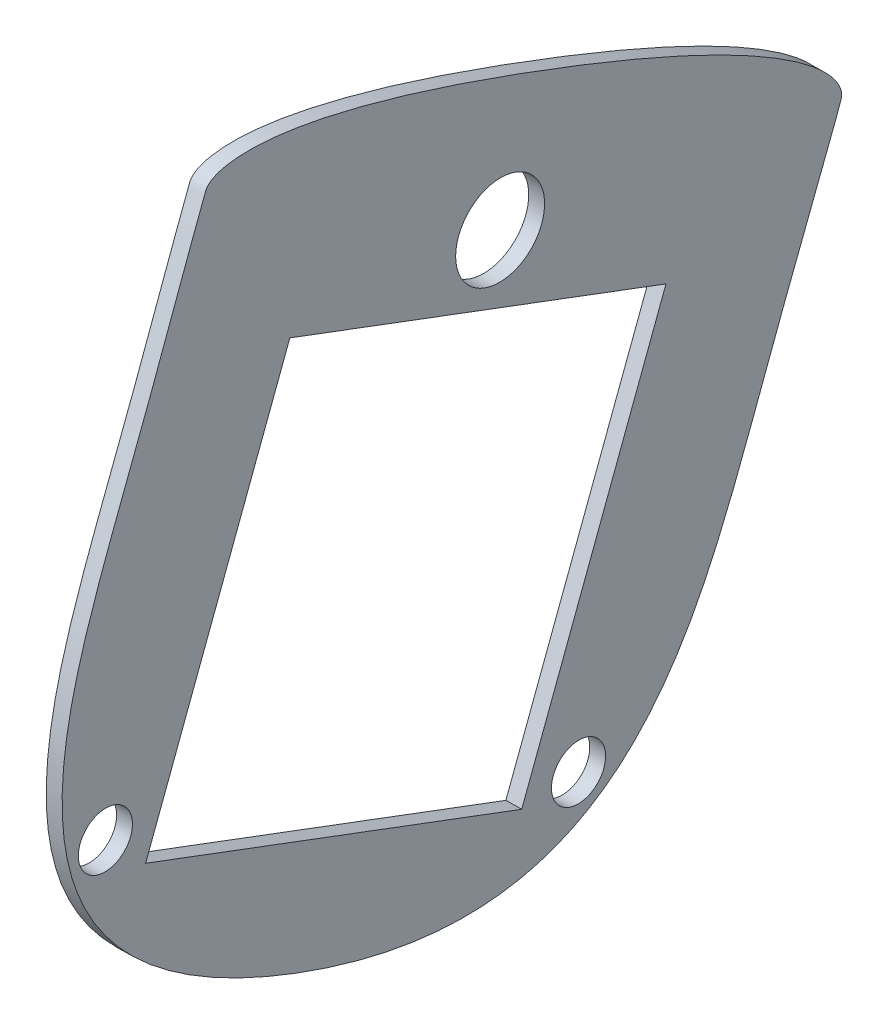
from build123d import *

# Parameters (mm, degrees)
SKETCH3_R               = 11.5
SKETCH3_R_2             = 7
BOSS_EXTRUDE1_DEPTH     = 4
CUT_EXTRUDE1_DEPTH      = 215.260535492
CUT_EXTRUDE1_DEPTH_BACK = 215.260535492


with BuildPart() as part:
    # Sketch3 → Boss-Extrude1 (new body)
    with BuildSketch(Plane(origin=(-1179.548631244, -0.000116963, 14.971959902), x_dir=(0.012691934504714668, 1.258519915397729e-09, 0.9999194541554475), z_dir=(-0.9999194541554426, -9.915104323779702e-08, 0.01269193450471473))):
        with BuildLine():
            add(Edge.make_bspline(
                [(84.377905998, 170.073349611), (84.159146209, 170.614103737), (83.611445829, 171.645847401), (82.482488155, 172.968186199), (81.127474205, 174.032815338), (79.625504141, 174.851852168), (78.048065363, 175.46773216), (75.883744714, 176.067351893), (73.137504594, 176.493777281), (69.848329994, 176.668544918), (66.593182125, 176.609478461), (63.378982778, 176.382288344), (60.20731945, 176.028236357), (57.075408808, 175.575862287), (53.980573733, 175.044418403), (50.919287132, 174.448332656), (47.88858994, 173.797522358), (44.885549546, 173.100779506), (40.914701349, 172.117751202), (36.006584389, 170.801928289), (30.186228838, 169.112782921), (24.416677375, 167.331209331), (18.680858867, 165.470954437), (12.962867526, 163.537381585), (7.246752851, 161.536551279), (-0.392782545, 158.779747051), (-6.165961293, 156.613052059), (-13.94829591, 153.628587787), (-19.689671295, 151.379544623), (-27.213353042, 148.32138638), (-32.801411813, 145.987168864), (-38.34590917, 143.60168497), (-43.854658394, 141.149761563), (-49.33590569, 138.616774109), (-54.793159015, 135.98108416), (-59.322515753, 133.677749539), (-62.932447741, 131.753643877), (-65.631328698, 130.263773352), (-68.320076039, 128.721252072), (-70.99499306, 127.117580989), (-73.651650051, 125.443406131), (-76.283024477, 123.685640179), (-78.878235649, 121.828176014), (-81.420273295, 119.847929263), (-83.880369486, 117.71527683), (-86.209443734, 115.385980118), (-87.966528206, 113.232572142), (-89.175083533, 111.339467663), (-89.936337543, 109.826689125), (-90.505629637, 108.213285186), (-90.801403008, 106.515492236), (-90.756707116, 104.777199898), (-90.474046755, 103.643699911), (-90.084384795, 102.569480158), (-89.841034016, 101.911994363), (-89.541465442, 101.124116148), (-89.39022558, 100.730499307), (-89.238048509, 100.337045258), (-89.085953699, 99.943392047), (-88.933536811, 99.549679266), (-88.730132992, 99.024564877), (-88.373481405, 98.105259575), (-87.862190511, 96.790888427), (-87.245924635, 95.211881522), (-86.627148474, 93.631055189), (-86.006043621, 92.048360056), (-85.382804113, 90.46374254), (-84.757617465, 88.87715131), (-84.130649567, 87.288544234), (-83.502064493, 85.697879827), (-82.662014846, 83.574195152), (-81.608733884, 80.914237535), (-80.340964507, 77.713392714), (-79.070680925, 74.503319887), (-77.799405763, 71.283624353), (-76.528661796, 68.053911872), (-75.259433457, 64.814004725), (-73.992705385, 61.563725615), (-72.730871393, 58.302409625), (-71.476325612, 55.029392149), (-69.810026434, 50.651412822), (-67.733040223, 45.155857397), (-65.192889969, 38.548535597), (-63.002092293, 33.047031135), (-61.179682785, 28.661451936), (-60.006324985, 25.929654584), (-59.043849556, 23.751341903), (-58.309275854, 22.121773372), (-57.56111242, 20.496992747), (-56.798597272, 18.877580965), (-56.02074925, 17.264200326), (-55.227016605, 15.657353665), (-54.415921139, 14.057888772), (-52.755061989, 10.875871272), (-50.113640526, 6.170533326), (-46.214055624, 0.106202959), (-41.879815211, -5.682640377), (-37.071022669, -11.095491143), (-31.749304366, -16.030968238), (-26.892659915, -19.643471605), (-22.77171096, -22.182742504), (-18.509010649, -24.473419396), (-12.935749295, -26.848778135), (-5.968718292, -28.897564796), (1.173532604, -30.167771585), (8.394625718, -30.72426012), (15.629246847, -30.639249774), (22.822176795, -29.99272502), (29.944943646, -28.856179071), (36.971413373, -27.310529127), (46.200981004, -24.782274948), (52.958186926, -22.450860484), (61.81972476, -19.052528076), (68.404073328, -16.267470827), (76.95838131, -11.975451151), (83.217088787, -8.426029178), (89.273667966, -4.508006235), (95.054577362, -0.17870119), (100.490854379, 4.595986977), (105.487967549, 9.838586932), (109.949080227, 15.559099084), (113.759190042, 21.741276151), (116.314593096, 27.234185766), (117.952211322, 31.787728825), (119.31821366, 36.431290069), (120.513597166, 42.364707849), (121.170203082, 49.592689871), (121.126324228, 56.832595149), (120.478268293, 64.034720651), (119.322900557, 71.151036814), (118.140760893, 76.415668184), (117.248089102, 79.892054693), (116.781726531, 81.623608795), (116.297499658, 83.349034553), (115.797104501, 85.068701615), (115.281277137, 86.782601375), (114.751194296, 88.490899321), (114.207808244, 90.193672228), (113.466976478, 92.456831493), (112.512877939, 95.2725252), (110.935633256, 99.751829279), (108.886186051, 105.307189462), (106.357132583, 111.918384124), (104.227035857, 117.393292318), (102.538795023, 121.76266191), (101.283192002, 125.035142736), (100.040826281, 128.303809705), (98.809473322, 131.567557235), (97.586908616, 134.825280211), (96.372281382, 138.076452947), (95.164740704, 141.32055023), (93.962890537, 144.556847836), (92.765334624, 147.784622), (91.769947764, 150.466802963), (90.974582637, 152.607652643), (90.37838073, 154.210763325), (89.782350048, 155.811268218), (89.186340893, 157.409088573), (88.590201531, 159.004144829), (87.993758439, 160.596349912), (87.396830825, 162.185613775), (86.799251704, 163.771852109), (86.300563928, 165.091116339), (85.951056972, 166.013206231), (85.751175589, 166.539698033), (85.601252796, 166.934387123), (85.451115071, 167.328812398), (85.301183692, 167.723146525), (85.150455373, 168.116984379), (84.846354037, 168.903163888), (84.587677769, 169.554813042), (84.377905998, 170.073349611)],
                knots=[0, 0, 0, 0, 0.002677759, 0.005355518, 0.008033277, 0.010711036, 0.013388795, 0.016066554, 0.021422071, 0.026777589, 0.032133107, 0.037488625, 0.042844143, 0.048199661, 0.053555179, 0.058910696, 0.064266214, 0.069621732, 0.07497725, 0.085688286, 0.096399321, 0.107110357, 0.117821393, 0.128532429, 0.139243464, 0.1499545, 0.171376571, 0.171376571, 0.192798208, 0.203509027, 0.214219845, 0.224930663, 0.235641482, 0.2463523, 0.257063118, 0.267773937, 0.273129346, 0.278484755, 0.283840164, 0.289195574, 0.294550983, 0.299906392, 0.305261801, 0.31061721, 0.31597262, 0.321328029, 0.326683438, 0.329361143, 0.332038847, 0.334716552, 0.337394256, 0.340071961, 0.342749665, 0.342749665, 0.345316694, 0.345958451, 0.346600208, 0.347241965, 0.347883722, 0.348525479, 0.349167236, 0.350450751, 0.353017779, 0.355584807, 0.358151836, 0.360718864, 0.363285893, 0.365852921, 0.368419949, 0.370986978, 0.373554006, 0.378688063, 0.38382212, 0.388956176, 0.394090233, 0.39922429, 0.404358347, 0.409492403, 0.41462646, 0.419760517, 0.424894574, 0.435162687, 0.445430801, 0.455698914, 0.460832971, 0.465967028, 0.468534056, 0.471101084, 0.473668113, 0.476235141, 0.478802169, 0.481369198, 0.483936226, 0.486503255, 0.496771368, 0.507039482, 0.517307595, 0.527575709, 0.537843822, 0.548111936, 0.553245992, 0.558380049, 0.568648163, 0.578916276, 0.58918439, 0.599452503, 0.609720617, 0.61998873, 0.630256844, 0.640524957, 0.650793071, 0.671329298, 0.671329298, 0.691871217, 0.702142176, 0.712413135, 0.722684095, 0.732955054, 0.743226014, 0.753496973, 0.763767933, 0.774038892, 0.784309852, 0.789445331, 0.794580811, 0.80485177, 0.81512273, 0.825393689, 0.835664649, 0.845935608, 0.856206568, 0.858774308, 0.861342047, 0.863909787, 0.866477527, 0.869045267, 0.871613007, 0.874180747, 0.876748487, 0.881883966, 0.887019446, 0.897290406, 0.907561365, 0.917832324, 0.922967804, 0.928103284, 0.933238764, 0.938374243, 0.943509723, 0.948645203, 0.953780682, 0.958916162, 0.964051642, 0.969187122, 0.971754862, 0.974322601, 0.976890341, 0.979458081, 0.982025821, 0.984593561, 0.987161301, 0.989729041, 0.99229678, 0.99358065, 0.994222585, 0.99486452, 0.995506455, 0.99614839, 0.996790325, 0.99743226, 1, 1, 1, 1], degree=3))
        make_face()
        with Locations((3.088369787, 120.842225121)):
            Circle(SKETCH3_R, mode=Mode.SUBTRACT)
        with Locations((-17.186648299, -9.215855238)):
            Circle(SKETCH3_R_2, mode=Mode.SUBTRACT)
        Polygon((94.736446449, 27.279702875), (-2.498711879, -10.009217528), (-39.787632282, 87.2259408), (57.447526046, 124.514861203), align=None, mode=Mode.SUBTRACT)
        with Locations((105.127599262, 37.690699139)):
            Circle(SKETCH3_R_2, mode=Mode.SUBTRACT)
    extrude(amount=-BOSS_EXTRUDE1_DEPTH)

    # Sketch7 → Cut-Extrude1 (cut, two sides: drawn at the far end of the back side and taken through both)
    with BuildSketch(Plane(origin=(-1175.548953427, -0.000116566, 14.921192164), x_dir=(-0.012691934504714949, -1.2585199174118205e-09, -0.9999194541554475), z_dir=(0.9999194541554426, 9.915104339647264e-08, -0.012691934504715011)).offset(-CUT_EXTRUDE1_DEPTH_BACK)):
        with BuildLine():
            add(Edge.make_bspline(
                [(-84.377905998, 170.073349611), (-84.587677769, 169.554813042), (-84.846354037, 168.903163888), (-85.150455373, 168.116984379), (-85.301183692, 167.723146525), (-85.451115071, 167.328812398), (-85.601252796, 166.934387123), (-85.751175589, 166.539698033), (-85.951056972, 166.013206232), (-86.300563928, 165.091116339), (-86.799251704, 163.771852109), (-87.396830825, 162.185613775), (-87.993758439, 160.596349912), (-88.590201531, 159.004144829), (-89.186340893, 157.409088573), (-89.782350048, 155.811268218), (-90.37838073, 154.210763325), (-90.974582637, 152.607652643), (-91.769947764, 150.466802963), (-92.765334624, 147.784622001), (-93.962890537, 144.556847836), (-95.164740704, 141.32055023), (-96.372281382, 138.076452947), (-97.586908616, 134.825280211), (-98.809473322, 131.567557235), (-100.040826281, 128.303809705), (-101.283192002, 125.035142736), (-102.538795023, 121.76266191), (-104.227035857, 117.393292318), (-106.357132583, 111.918384124), (-108.886186051, 105.307189462), (-110.935633256, 99.751829279), (-112.512877939, 95.2725252), (-113.466976478, 92.456831493), (-114.207808244, 90.193672228), (-114.751194296, 88.490899321), (-115.281277137, 86.782601375), (-115.797104501, 85.068701616), (-116.297499658, 83.349034553), (-116.781726531, 81.623608795), (-117.248089102, 79.892054693), (-118.140760893, 76.415668184), (-119.322900557, 71.151036814), (-120.478268293, 64.034720651), (-121.126324228, 56.832595149), (-121.170203082, 49.592689871), (-120.513597166, 42.364707849), (-119.31821366, 36.431290069), (-117.952211322, 31.787728825), (-116.314593096, 27.234185766), (-113.759190042, 21.741276151), (-109.949080227, 15.559099084), (-105.487967549, 9.838586932), (-100.490854379, 4.595986977), (-95.054577362, -0.17870119), (-89.273667966, -4.508006235), (-83.217088787, -8.426029178), (-76.95838131, -11.975451151), (-68.404073328, -16.267470827), (-61.81972476, -19.052528076), (-52.958186926, -22.450860484), (-46.200981004, -24.782274948), (-36.971413373, -27.310529127), (-29.944943646, -28.856179071), (-22.822176795, -29.99272502), (-15.629246847, -30.639249774), (-8.394625718, -30.72426012), (-1.173532604, -30.167771585), (5.968718292, -28.897564796), (12.935749295, -26.848778135), (18.509010649, -24.473419396), (22.77171096, -22.182742504), (26.892659915, -19.643471605), (31.749304366, -16.030968238), (37.071022669, -11.095491143), (41.879815211, -5.682640377), (46.214055624, 0.106202959), (50.113640526, 6.170533326), (52.755061989, 10.875871272), (54.415921139, 14.057888772), (55.227016605, 15.657353665), (56.02074925, 17.264200326), (56.798597272, 18.877580965), (57.561112421, 20.496992747), (58.309275854, 22.121773372), (59.043849556, 23.751341903), (60.006324985, 25.929654584), (61.179682785, 28.661451936), (63.002092293, 33.047031135), (65.192889969, 38.548535597), (67.733040223, 45.155857397), (69.810026434, 50.651412822), (71.476325612, 55.029392149), (72.730871393, 58.302409625), (73.992705385, 61.563725615), (75.259433457, 64.814004725), (76.528661796, 68.053911872), (77.799405763, 71.283624353), (79.070680925, 74.503319887), (80.340964507, 77.713392714), (81.608733884, 80.914237535), (82.662014846, 83.574195152), (83.502064493, 85.697879827), (84.130649567, 87.288544235), (84.757617465, 88.87715131), (85.382804113, 90.46374254), (86.006043621, 92.048360056), (86.627148474, 93.631055189), (87.245924635, 95.211881522), (87.862190511, 96.790888427), (88.373481405, 98.105259575), (88.730132992, 99.024564877), (88.933536811, 99.549679266), (89.085953699, 99.943392047), (89.238048509, 100.337045258), (89.39022558, 100.730499307), (89.541465442, 101.124116148), (89.841034016, 101.911994363), (90.084384795, 102.569480158), (90.474046755, 103.643699911), (90.756707116, 104.777199898), (90.801403008, 106.515492236), (90.505629637, 108.213285186), (89.936337543, 109.826689125), (89.175083533, 111.339467663), (87.966528206, 113.232572142), (86.209443734, 115.385980118), (83.880369486, 117.71527683), (81.420273295, 119.847929263), (78.878235649, 121.828176014), (76.283024477, 123.685640179), (73.651650051, 125.443406131), (70.99499306, 127.117580989), (68.320076039, 128.721252072), (65.631328698, 130.263773352), (62.932447741, 131.753643877), (59.322515753, 133.677749539), (54.793159015, 135.98108416), (49.33590569, 138.616774109), (43.854658394, 141.149761563), (38.34590917, 143.60168497), (32.801411813, 145.987168864), (27.213353042, 148.32138638), (19.689671295, 151.379544623), (13.94829591, 153.628587787), (6.165961293, 156.613052059), (0.392782545, 158.779747051), (-7.246752851, 161.536551279), (-12.962867526, 163.537381585), (-18.680858867, 165.470954437), (-24.416677375, 167.331209331), (-30.186228838, 169.112782921), (-36.006584389, 170.801928289), (-40.914701349, 172.117751202), (-44.885549546, 173.100779506), (-47.88858994, 173.797522358), (-50.919287132, 174.448332656), (-53.980573733, 175.044418403), (-57.075408808, 175.575862287), (-60.20731945, 176.028236357), (-63.378982778, 176.382288344), (-66.593182125, 176.609478461), (-69.848329994, 176.668544918), (-73.137504594, 176.493777281), (-75.883744714, 176.067351893), (-78.048065363, 175.46773216), (-79.625504141, 174.851852168), (-81.127474205, 174.032815338), (-82.482488155, 172.968186199), (-83.611445829, 171.645847401), (-84.159146209, 170.614103737), (-84.377905998, 170.073349611)],
                knots=[0, 0, 0, 0, 0.00256774, 0.003209675, 0.00385161, 0.004493545, 0.00513548, 0.005777415, 0.00641935, 0.00770322, 0.010270959, 0.012838699, 0.015406439, 0.017974179, 0.020541919, 0.023109659, 0.025677399, 0.028245138, 0.030812878, 0.035948358, 0.041083838, 0.046219318, 0.051354797, 0.056490277, 0.061625757, 0.066761236, 0.071896716, 0.077032196, 0.082167676, 0.092438635, 0.102709594, 0.112980554, 0.118116034, 0.123251513, 0.125819253, 0.128386993, 0.130954733, 0.133522473, 0.136090213, 0.138657953, 0.141225692, 0.143793432, 0.154064392, 0.164335351, 0.174606311, 0.18487727, 0.19514823, 0.205419189, 0.210554669, 0.215690148, 0.225961108, 0.236232067, 0.246503027, 0.256773986, 0.267044946, 0.277315905, 0.287586865, 0.297857824, 0.308128783, 0.328670702, 0.328670702, 0.349206929, 0.359475043, 0.369743156, 0.38001127, 0.390279383, 0.400547497, 0.41081561, 0.421083724, 0.431351837, 0.441619951, 0.446754008, 0.451888064, 0.462156178, 0.472424291, 0.482692405, 0.492960518, 0.503228632, 0.513496745, 0.516063774, 0.518630802, 0.521197831, 0.523764859, 0.526331887, 0.528898916, 0.531465944, 0.534032972, 0.539167029, 0.544301086, 0.554569199, 0.564837313, 0.575105426, 0.580239483, 0.58537354, 0.590507597, 0.595641653, 0.60077571, 0.605909767, 0.611043824, 0.61617788, 0.621311937, 0.626445994, 0.629013022, 0.631580051, 0.634147079, 0.636714107, 0.639281136, 0.641848164, 0.644415193, 0.646982221, 0.649549249, 0.650832764, 0.651474521, 0.652116278, 0.652758035, 0.653399792, 0.654041549, 0.654683306, 0.657250335, 0.657250335, 0.659928039, 0.662605744, 0.665283448, 0.667961153, 0.670638857, 0.673316562, 0.678671971, 0.68402738, 0.68938279, 0.694738199, 0.700093608, 0.705449017, 0.710804426, 0.716159836, 0.721515245, 0.726870654, 0.732226063, 0.742936882, 0.7536477, 0.764358518, 0.775069337, 0.785780155, 0.796490973, 0.807201792, 0.828623429, 0.828623429, 0.8500455, 0.860756536, 0.871467571, 0.882178607, 0.892889643, 0.903600679, 0.914311714, 0.92502275, 0.930378268, 0.935733786, 0.941089304, 0.946444821, 0.951800339, 0.957155857, 0.962511375, 0.967866893, 0.973222411, 0.978577929, 0.983933446, 0.986611205, 0.989288964, 0.991966723, 0.994644482, 0.997322241, 1, 1, 1, 1], degree=3))
        make_face()
        with BuildLine():
            add(Edge.make_bspline(
                [(-55.838187915, -16.709006158), (-52.759337993, -17.889720929), (-49.661983589, -18.990343474), (-43.424834759, -21.007897071), (-40.285339262, -21.92612196), (-33.955770812, -23.543659309), (-30.765739772, -24.24315318), (-24.32356293, -25.373292006), (-21.071285211, -25.803365996), (-16.956515513, -26.12704479), (-16.131072797, -26.18100847), (-14.474843152, -26.265804691), (-13.644083081, -26.296583324), (-11.159336056, -26.351552112), (-9.507722379, -26.338718419), (-4.568918462, -26.137757417), (-1.297671373, -25.78812208), (2.759472487, -25.027771111), (3.569293765, -24.859416605), (5.18553302, -24.488231331), (5.993775065, -24.284843954), (8.399228786, -23.623868124), (9.971586965, -23.117864588), (14.595084925, -21.404330612), (17.551875198, -19.999661802), (21.794962334, -17.491279284), (23.177855615, -16.589398743), (25.205437224, -15.138878878), (25.873321198, -14.639057008), (27.181089471, -13.616839589), (27.822584958, -13.093252227), (30.970670356, -10.4154919), (33.301166003, -8.083945357), (36.567419281, -4.355468118), (37.618355142, -3.072810403), (39.64697293, -0.440910656), (40.616764166, 0.897801763), (43.411580637, 4.972513852), (45.123166514, 7.766516767), (48.319174964, 13.470674596), (49.801929662, 16.381682321), (52.604978459, 22.286766309), (53.932733365, 25.27702775), (57.766509572, 34.324247789), (60.125505586, 40.458843727), (63.606479117, 49.676665059), (64.757269397, 52.752894779), (67.079227601, 58.897611565), (68.252385082, 61.965346645), (71.805480231, 71.155752539), (74.213167338, 77.267445065), (79.035873492, 89.487950781), (81.4480823, 95.597900416), (83.986552954, 102.099289952), (84.135965475, 102.481689786), (84.425807975, 103.249939652), (84.567492243, 103.635368235), (84.775543036, 104.214978291), (84.878518455, 104.505119932), (84.980118381, 104.795702546), (85.047566748, 104.98951563), (85.079528904, 105.086987063), (85.158366234, 105.384867175), (85.192220325, 105.59176206), (85.218840022, 106.001049619), (85.212210813, 106.204511309), (85.142942569, 106.811968847), (85.034682826, 107.21510388), (84.756266, 107.982246278), (84.583912253, 108.351859442), (84.196478614, 109.073093102), (83.981597313, 109.423825158), (83.52983243, 110.100642568), (83.291405329, 110.428377632), (82.547651515, 111.387356945), (82.015005621, 111.995356629), (80.901216342, 113.170091836), (80.319686954, 113.737050911), (78.52328478, 115.390418973), (77.270566315, 116.418862701), (74.700393567, 118.389068942), (73.381782394, 119.32928238), (70.698287892, 121.147750868), (69.331687918, 122.02679594), (65.195548924, 124.584259877), (62.387747423, 126.186203907), (56.709877694, 129.262739183), (53.839156931, 130.735995811), (48.053014111, 133.591082483), (45.137324154, 134.972364597), (36.339127545, 139.011642528), (30.406162908, 141.566437723), (18.451720965, 146.494995074), (12.437018015, 148.864913384), (0.357542405, 153.462385383), (-5.709469349, 155.68726841), (-17.91971089, 159.930649665), (-24.065774352, 161.952538875), (-33.353609981, 164.737568582), (-36.461496278, 165.624091526), (-42.709502751, 167.284247331), (-45.851639663, 168.058795224), (-50.590157012, 169.093614662), (-52.173909965, 169.417459848), (-55.352415201, 170.010519303), (-56.948046065, 170.280112582), (-60.149000954, 170.746654828), (-61.75366471, 170.943774648), (-64.975017035, 171.234172809), (-66.592148459, 171.328539114), (-69.016230852, 171.346695582), (-69.824478456, 171.331719417), (-71.441564235, 171.245353865), (-72.246522091, 171.174124812), (-73.839454431, 170.951022433), (-74.628476044, 170.800346521), (-75.79286968, 170.473749161), (-76.177880347, 170.348483417), (-76.938003474, 170.04593209), (-77.306783319, 169.871111149), (-78.004511865, 169.450955655), (-78.338069673, 169.204193653), (-78.755434715, 168.759826376), (-78.882714896, 168.596790132), (-79.046744631, 168.337519457), (-79.09676909, 168.249129551), (-79.188247593, 168.068727216), (-79.228553278, 167.976229402), (-79.579983644, 167.13896402), (-79.883719051, 166.391073173), (-80.318893928, 165.260602343), (-80.460330398, 164.882248454), (-80.745039008, 164.126320492), (-80.887268693, 163.748309881), (-81.313688634, 162.614177355), (-81.597507379, 161.85791643), (-84.149346857, 155.050621742), (-86.400830539, 148.993395659), (-90.916049065, 136.883544743), (-93.183678853, 130.832392804), (-96.65064514, 121.780338952), (-97.820733033, 118.768429246), (-100.17276594, 112.749163304), (-101.35316054, 109.741198399), (-103.682933583, 103.713451482), (-104.833000083, 100.693931619), (-107.063020867, 94.628179247), (-108.143649833, 91.579887613), (-111.206491475, 82.395365442), (-113.022345432, 76.218403771), (-114.962254926, 66.765882258), (-115.481062493, 63.58453406), (-116.004417348, 58.751687631), (-116.1361902, 57.126095325), (-116.299640106, 53.886397077), (-116.331785516, 52.269889591), (-116.265881331, 47.431308802), (-116.006818315, 44.220087729), (-115.353260653, 40.228284963), (-115.206066361, 39.43103534), (-114.877610559, 37.838832209), (-114.695820777, 37.041884532), (-114.101862551, 34.672495297), (-113.641676827, 33.121538816), (-112.066595914, 28.555418138), (-110.753582897, 25.628605508), (-108.407961861, 21.406110782), (-107.563368978, 20.02658246), (-106.202155505, 17.999354271), (-105.732692007, 17.330754187), (-104.77274775, 16.019910199), (-104.281147156, 15.375951976), (-101.768281805, 12.210246223), (-99.583575441, 9.849625467), (-94.925581005, 5.412878466), (-92.452216447, 3.336827622), (-88.562681396, 0.399697469), (-87.244321579, -0.543609916), (-84.574455243, -2.36248415), (-83.221952517, -3.238791123), (-79.117613597, -5.779405368), (-76.319483157, -7.356417612), (-70.622341154, -10.320214999), (-67.72332605, -11.706993463), (-63.312072682, -13.66887261), (-61.831048368, -14.302832067), (-59.594632684, -15.225714176), (-58.472704701, -15.680140322), (-57.157500421, -16.198446591), (-56.498353769, -16.454687308), (-56.215534326, -16.563886223), (-56.026915464, -16.636548663), (-55.934401975, -16.672108822), (-55.838187915, -16.709006158)],
                knots=[0, 0, 0, 0, 0.015625, 0.015625, 0.03125, 0.03125, 0.046875, 0.046875, 0.0625, 0.0625, 0.06640625, 0.06640625, 0.0703125, 0.0703125, 0.078125, 0.078125, 0.09375, 0.09375, 0.09765625, 0.09765625, 0.1015625, 0.1015625, 0.109375, 0.109375, 0.125, 0.125, 0.1328125, 0.1328125, 0.13671875, 0.13671875, 0.140625, 0.140625, 0.15625, 0.15625, 0.1640625, 0.1640625, 0.171875, 0.171875, 0.1875, 0.1875, 0.203125, 0.203125, 0.21875, 0.21875, 0.25, 0.25, 0.265625, 0.265625, 0.28125, 0.28125, 0.3125, 0.3125, 0.34375, 0.34375, 0.345703125, 0.345703125, 0.34765625, 0.34765625, 0.348632812, 0.349121094, 0.349121094, 0.349609375, 0.349609375, 0.350585937, 0.350585937, 0.3515625, 0.3515625, 0.353515625, 0.353515625, 0.35546875, 0.35546875, 0.357421875, 0.357421875, 0.359375, 0.359375, 0.36328125, 0.36328125, 0.3671875, 0.3671875, 0.375, 0.375, 0.3828125, 0.3828125, 0.390625, 0.390625, 0.40625, 0.40625, 0.421875, 0.421875, 0.4375, 0.4375, 0.46875, 0.46875, 0.5, 0.5, 0.53125, 0.53125, 0.5625, 0.5625, 0.578125, 0.578125, 0.59375, 0.59375, 0.6015625, 0.6015625, 0.609375, 0.609375, 0.6171875, 0.6171875, 0.625, 0.625, 0.62890625, 0.62890625, 0.6328125, 0.6328125, 0.63671875, 0.63671875, 0.638671875, 0.638671875, 0.640625, 0.640625, 0.642578125, 0.642578125, 0.643554687, 0.643554687, 0.644042969, 0.644042969, 0.64453125, 0.64453125, 0.6484375, 0.6484375, 0.650390625, 0.650390625, 0.65234375, 0.65234375, 0.65625, 0.65625, 0.6875, 0.6875, 0.71875, 0.71875, 0.734375, 0.734375, 0.75, 0.75, 0.765625, 0.765625, 0.78125, 0.78125, 0.8125, 0.8125, 0.828125, 0.828125, 0.8359375, 0.8359375, 0.84375, 0.84375, 0.859375, 0.859375, 0.86328125, 0.86328125, 0.8671875, 0.8671875, 0.875, 0.875, 0.890625, 0.890625, 0.8984375, 0.8984375, 0.90234375, 0.90234375, 0.90625, 0.90625, 0.921875, 0.921875, 0.9375, 0.9375, 0.9453125, 0.9453125, 0.953125, 0.953125, 0.96875, 0.96875, 0.984375, 0.984375, 0.9921875, 0.9921875, 0.99609375, 0.998046875, 0.999023437, 0.999511719, 0.999511719, 1, 1, 1, 1], degree=3))
        make_face(mode=Mode.SUBTRACT)
    extrude(amount=CUT_EXTRUDE1_DEPTH + CUT_EXTRUDE1_DEPTH_BACK, mode=Mode.SUBTRACT)


solid = part.part
